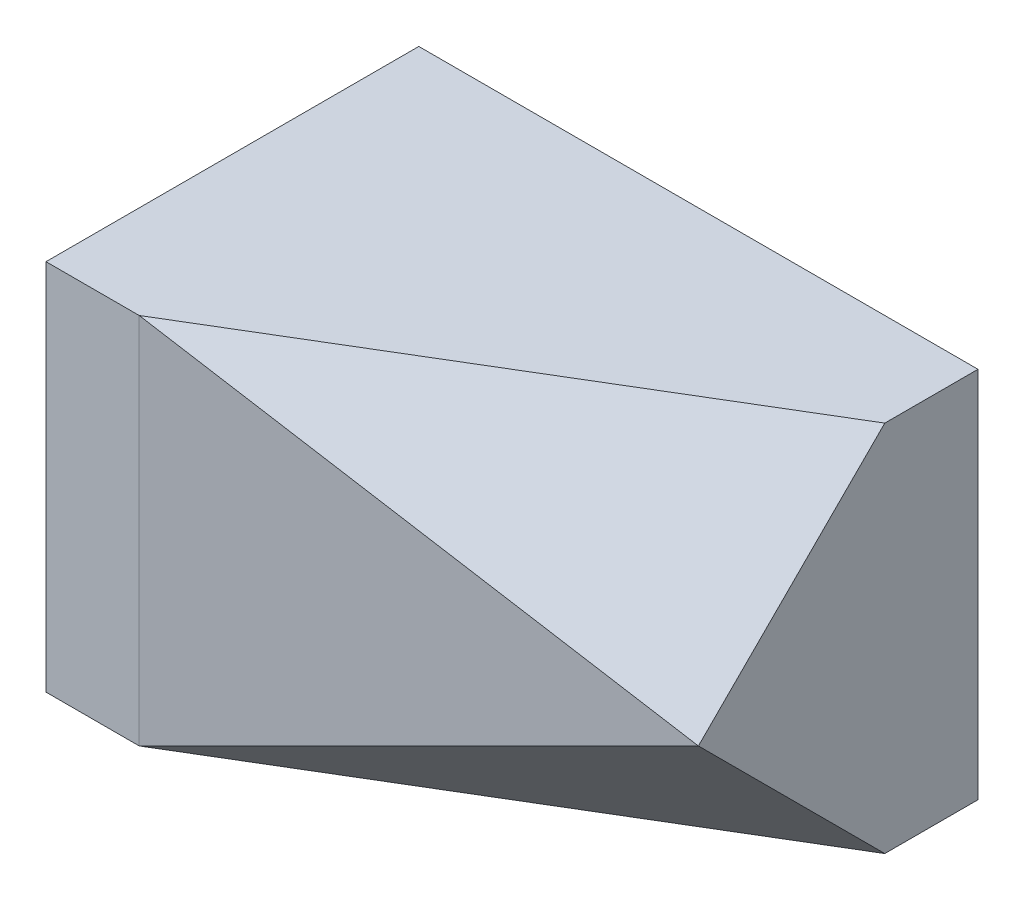
from build123d import *

# Parameters (mm, degrees)
EXTRUDE_1_DEPTH = 20
LOFT_1_DEPTH    = 20
LOFT_START      = -10.289915109
LOFT_1_2_DEPTH  = 36.01470288


with BuildPart() as part:
    # 草圖1 → 填料-伸長1 (new body)
    with BuildSketch(Plane(origin=(0, 0, 0), x_dir=(1, 0, 0), z_dir=(0, 1, 0))):
        Polygon((5, -20), (30, -5), (30, 0), (0, 0), (0, -20), align=None)
    extrude(amount=EXTRUDE_1_DEPTH)

    # 疊層拉伸1: read off the stored shape, not the designer's step
    # 疊層拉伸1 outline → 疊層拉伸1 (add)
    with BuildSketch(Plane(origin=(0, 0, 0), x_dir=(1, 0, 0), z_dir=(0, 1, 0))):
        Polygon((5, -20), (30, -15), (30, -5), align=None)
    extrude(amount=LOFT_1_DEPTH)

    # Loft 1 2 outline → Loft 1 2 (cut)
    with BuildSketch(Plane(origin=(0, 0, 0), x_dir=(0.5144957554275273, 0, 0.8574929257125438), z_dir=(0.8574929257125438, 0, -0.5144957554275271)).offset(LOFT_START)):
        Polygon((19.722337291, 0), (28.297266549, -10), (19.722337291, -20), (30, -20), (30, 0), align=None)
    extrude(amount=LOFT_1_2_DEPTH, mode=Mode.SUBTRACT)


solid = part.part
